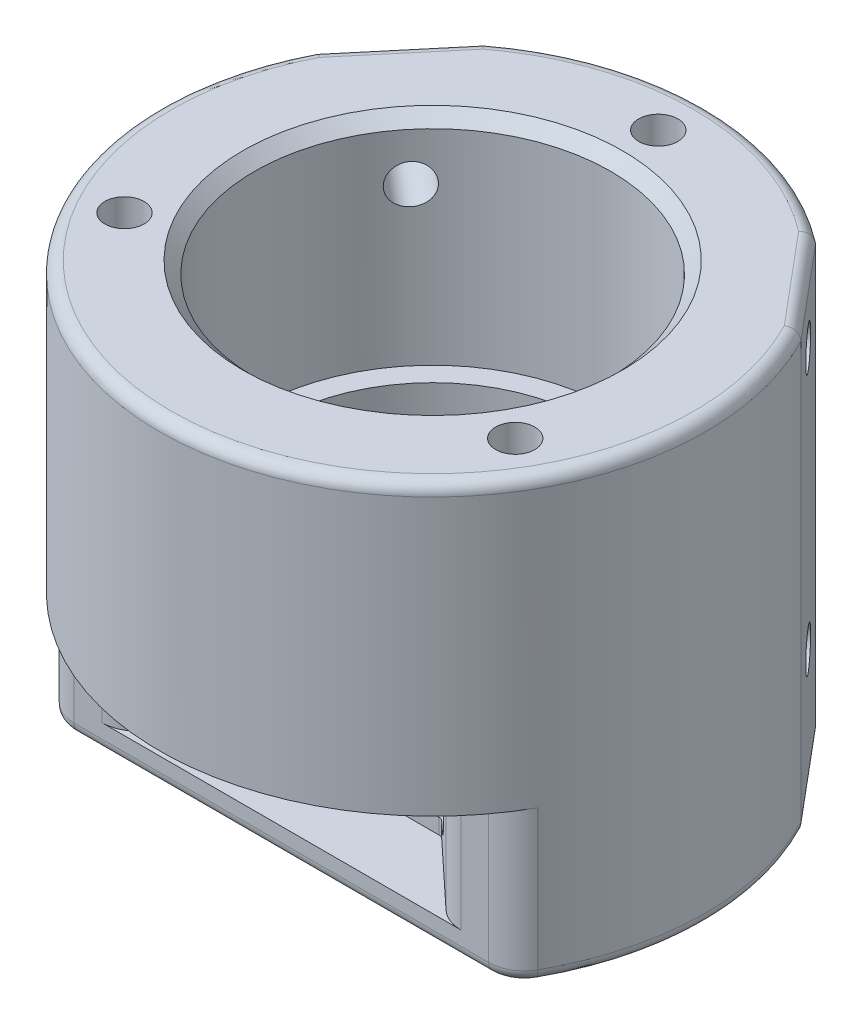
from build123d import *

# Parameters (mm, degrees)
CSK_FOR_M2_COUNTERSUNK_FLAT_HEAD_SCREW1_D           = 2.2
CSK_FOR_M2_COUNTERSUNK_FLAT_HEAD_SCREW1_CSINK_D     = 4.4
CSK_FOR_M2_COUNTERSUNK_FLAT_HEAD_SCREW1_CSINK_ANGLE = 90
CUT_EXTRUDE1_DEPTH                                  = 9.319
CUT_EXTRUDE1_DEPTH_BACK                             = 1.3
FILLET1_R                                           = 3
FILLET2_R                                           = 2
CUT_EXTRUDE3_START                                  = -1.35
CUT_EXTRUDE3_DEPTH                                  = 1.35
M4_TAPPED_HOLE2_D                                   = 3.3
M4_TAPPED_HOLE2_DEPTH                               = 10.1
M4_TAPPED_HOLE2_TIP                                 = 0.991420021
M2_5_TAPPED_HOLE1_D                                 = 2.05
M2_5_TAPPED_HOLE1_DEPTH                             = 6.35
M2_5_TAPPED_HOLE1_TIP                               = 0.615882135
CUT_EXTRUDE4_REACH                                  = 51.335
SKETCH11_OUTSIDE_W                                  = 62.978
SKETCH11_OUTSIDE_H                                  = 62.978
CUT_EXTRUDE2_DEPTH                                  = 50.335229157
FILLET3_R                                           = 1
CHAMFER1_SIZE                                       = 1
M4_TAPPED_HOLE1_AT_2_COUNT                          = 2
M4_TAPPED_HOLE1_AT_2_PITCH                          = 22
FILLET4_R                                           = 0.5


with BuildPart() as part:
    # Sketch1 → Revolve1 (revolve)
    with BuildSketch(Plane(origin=(0, 0, 0), x_dir=(0, 0, -1), z_dir=(1, 0, 0))):
        Polygon((13.2, 3.5), (13.2, 18.844), (15, 18.844), (15, 37.094), (23, 37.094), (23, 16.013248777), (23, 0), (8.5, 0), (5.5, 0), (5.5, 1.35), (3.75, 1.35), (3.75, 3.5), align=None)
    revolve(axis=Axis((0, 0, 0), (0, 1, 0)))

    # CSK for M2 Countersunk Flat Head Screw1 (through all)
    with Locations(Plane(origin=(0, 3.5, 0), x_dir=(1, 0, 0), z_dir=(0, 1, 0))):
        with Locations((0, 6.5), (-5.629165125, -3.25), (5.629165125, -3.25)):
            CounterSinkHole(CSK_FOR_M2_COUNTERSUNK_FLAT_HEAD_SCREW1_D / 2, CSK_FOR_M2_COUNTERSUNK_FLAT_HEAD_SCREW1_CSINK_D / 2, counter_sink_angle=CSK_FOR_M2_COUNTERSUNK_FLAT_HEAD_SCREW1_CSINK_ANGLE)

    # Sketch5 → Cut-Extrude1 (cut, two sides: drawn at the far end of the back side and taken through both)
    with BuildSketch(Plane(origin=(0, 3.5, 0), x_dir=(1, 0, 0), z_dir=(0, 1, 0)).offset(-CUT_EXTRUDE1_DEPTH_BACK)):
        with BuildLine():
            Line((-13.5, -18.62122445), (-13.5, -29.562959847))
            Line((-13.5, -29.562959847), (13.5, -29.562959847))
            Line((13.5, -29.562959847), (13.5, -18.62122445))
            ThreePointArc((13.5, -18.62122445), (16.584015432, -15.936449797), (19.14388926, -12.748))
            Line((19.14388926, -12.748), (13.93421226, -12.748))
            Line((13.93421226, -12.748), (7.5, -6.748))
            Line((7.5, -6.748), (-7.5, -6.748))
            Line((-7.5, -6.748), (-13.93421226, -12.748))
            Line((-13.93421226, -12.748), (-19.14388926, -12.748))
            ThreePointArc((-19.14388926, -12.748), (-16.584015432, -15.936449797), (-13.5, -18.62122445))
        make_face()
    extrude(amount=CUT_EXTRUDE1_DEPTH + CUT_EXTRUDE1_DEPTH_BACK, mode=Mode.SUBTRACT)

    # Fillet1
    fillet1_edges = [part.edges().sort_by_distance(p)[0] for p in [
        (-19.14388926, 7.5095, 12.748),
        (-13.93421226, 7.5095, 12.748),
        (13.93421226, 7.5095, 12.748),
        (19.14388926, 7.5095, 12.748),
    ]]
    fillet(fillet1_edges, radius=FILLET1_R)

    # Fillet2
    fillet2_edges = [part.edges().sort_by_distance(p)[0] for p in [
        (12.06906123, 3.5, -5.345817152),
    ]]
    fillet(fillet2_edges, radius=FILLET2_R)

    # Sketch14 → Cut-Extrude3 (cut)
    with BuildSketch(Plane.XZ.offset(CUT_EXTRUDE3_START)):
        with BuildLine():
            Line((1.1, -6.5), (1.1, -5.388877434))
            ThreePointArc((1.1, -5.388877434), (4.763139721, -2.75), (5.216904756, 1.741810773))
            Line((5.216904756, 1.741810773), (6.179165125, 2.297372056))
            ThreePointArc((6.179165125, 2.297372056), (6.581793069, 3.8), (5.079165125, 4.202627944))
            Line((5.079165125, 4.202627944), (4.116904756, 3.647066661))
            ThreePointArc((4.116904756, 3.647066661), (0, 5.5), (-4.116904756, 3.647066661))
            Line((-4.116904756, 3.647066661), (-5.079165125, 4.202627944))
            ThreePointArc((-5.079165125, 4.202627944), (-6.581793069, 3.8), (-6.179165125, 2.297372056))
            Line((-6.179165125, 2.297372056), (-5.216904756, 1.741810773))
            ThreePointArc((-5.216904756, 1.741810773), (-4.763139721, -2.75), (-1.1, -5.388877434))
            Line((-1.1, -5.388877434), (-1.1, -6.5))
            ThreePointArc((-1.1, -6.5), (0, -7.6), (1.1, -6.5))
        make_face()
    extrude(amount=CUT_EXTRUDE3_DEPTH, mode=Mode.SUBTRACT)

    # M4 Tapped Hole2
    with Locations(Plane(origin=(0, 37.094, 0), x_dir=(-1, 0, 0), z_dir=(0, 1, 0))):
        with Locations((16.454482672, 9.5), (0, -19), (-16.454482672, 9.5)):
            Hole(M4_TAPPED_HOLE2_D / 2, depth=M4_TAPPED_HOLE2_DEPTH)
            with Locations((0, 0, -(M4_TAPPED_HOLE2_DEPTH + M4_TAPPED_HOLE2_TIP / 2))):  # 118° drill point
                Cone(0, M4_TAPPED_HOLE2_D / 2, M4_TAPPED_HOLE2_TIP, mode=Mode.SUBTRACT)

    # M2.5 Tapped Hole1
    with Locations(Plane(origin=(0, 12.819, 0), x_dir=(-1, 0, 0), z_dir=(0, -1, 0))):
        with Locations((-10.4775, -15.748), (10.4775, -15.748)):
            Hole(M2_5_TAPPED_HOLE1_D / 2, depth=M2_5_TAPPED_HOLE1_DEPTH)
            with Locations((0, 0, -(M2_5_TAPPED_HOLE1_DEPTH + M2_5_TAPPED_HOLE1_TIP / 2))):  # 118° drill point
                Cone(0, M2_5_TAPPED_HOLE1_D / 2, M2_5_TAPPED_HOLE1_TIP, mode=Mode.SUBTRACT)

    # Sketch15 → Cut-Extrude4 (cut, up to next)
    with BuildSketch(Plane.XZ, mode=Mode.PRIVATE) as cut_extrude4_sk1:
        with BuildLine():
            Line((15.115943687, 12.748), (17.463576266, 12.748))
            ThreePointArc((17.463576266, 12.748), (18.982358673, 12.335141279), (20.083112706, 11.2102))
            ThreePointArc((20.083112706, 11.2102), (0, 23), (-20.083112706, 11.2102))
            ThreePointArc((-20.083112706, 11.2102), (-18.982358673, 12.335141279), (-17.463576266, 12.748))
            Line((-17.463576266, 12.748), (-15.115943687, 12.748))
            Line((-15.115943687, 12.748), (15.115943687, 12.748))
        make_face()
    cut_extrude4_tool1 = extrude(cut_extrude4_sk1.sketch, amount=-CUT_EXTRUDE4_REACH, mode=Mode.PRIVATE) & part.part
    add(cut_extrude4_tool1.solids().sort_by_distance((0, 0, 16.923735))[0], mode=Mode.SUBTRACT)

    # Sketch11 outside → Cut-Extrude2 (cut, through all)
    with BuildSketch(Plane(origin=(0, 0, 0), x_dir=(1, 0, 0), z_dir=(0, 1, 0))):
        Rectangle(SKETCH11_OUTSIDE_W, SKETCH11_OUTSIDE_H)
        with BuildLine():
            Line((13.983717047, 18.260768263), (20.411593144, 10.600323832))
            ThreePointArc((20.411593144, 10.600323832), (0, -23), (-20.411593144, 10.600323832))
            Line((-20.411593144, 10.600323832), (-13.983717047, 18.260768263))
            ThreePointArc((-13.983717047, 18.260768263), (0, 23), (13.983717047, 18.260768263))
        make_face(mode=Mode.SUBTRACT)
    extrude(amount=CUT_EXTRUDE2_DEPTH, mode=Mode.SUBTRACT)

    # Fillet3
    # the kernel refuses this fillet: 1 mm, written as the material it takes off along each edge
    with BuildSketch(Plane(origin=(0, 0, 0), x_dir=(-0.8322161318186808, 0, -0.5544513594002202), z_dir=(0.5544513594002202, 0, -0.8322161318186808))) as fillet3_piece_1:
        with BuildLine():
            CenterArc((23 - FILLET3_R, FILLET3_R), FILLET3_R, 270, 90)
            Line((23 - FILLET3_R, 0), (23, 0))
            Line((23, 0), (23, FILLET3_R))
        make_face()
    revolve(axis=Axis((0, 0, 0), (0, 1, 0)), revolution_arc=62.84276799, mode=Mode.SUBTRACT)
    with BuildSketch(Plane(origin=(17.463576266, 0, 9.748), x_dir=(0, 0, 1), z_dir=(-1, 0, 0))) as fillet3_piece_2:
        with BuildLine():
            CenterArc((3 - FILLET3_R, FILLET3_R), FILLET3_R, 270, 90)
            Line((3, FILLET3_R), (3, 0))
            Line((3, 0), (3 - FILLET3_R, 0))
        make_face()
    revolve(axis=Axis((17.463576266, 0, 9.748), (0, 1, 0)), revolution_arc=60.830166101, mode=Mode.SUBTRACT)
    with BuildSketch(Plane(origin=(-17.463576266, 0, 9.748), x_dir=(-0.8731788133022929, 0, 0.48739999999999956), z_dir=(-0.48739999999999956, 0, -0.8731788133022929))) as fillet3_piece_3:
        with BuildLine():
            CenterArc((3 - FILLET3_R, FILLET3_R), FILLET3_R, 270, 90)
            Line((3 - FILLET3_R, 0), (3, 0))
            Line((3, 0), (3, FILLET3_R))
        make_face()
    revolve(axis=Axis((-17.463576266, 0, 9.748), (0, 1, 0)), revolution_arc=60.830166101, mode=Mode.SUBTRACT)
    with BuildSketch(Plane(origin=(17.463576266, 0, 12.748), x_dir=(0, 1, 0), z_dir=(-1, 0, 0))) as fillet3_piece_4:
        with BuildLine():
            CenterArc((FILLET3_R, FILLET3_R), FILLET3_R, 180, 90)
            Line((0, FILLET3_R), (0, 0))
            Line((0, 0), (FILLET3_R, 0))
        make_face()
    extrude(amount=34.927152532, mode=Mode.SUBTRACT)
    with BuildSketch(Plane(origin=(0, 37.094, 0), x_dir=(-0.8320605059369173, 0, -0.5546848785211302), z_dir=(0.5546848785211302, 0, -0.8320605059369173))) as fillet3_piece_5:
        with BuildLine():
            CenterArc((23 - FILLET3_R, -FILLET3_R), FILLET3_R, 0, 90)
            Line((23 - FILLET3_R, 0), (23, 0))
            Line((23, 0), (23, -FILLET3_R))
        make_face()
    revolve(axis=Axis((0, 37.094, 0), (0, 1, 0)), revolution_arc=247.378025481, mode=Mode.SUBTRACT)
    with BuildSketch(Plane(origin=(0, 37.094, 0), x_dir=(0.6905501820120585, 0, -0.7232844849180111), z_dir=(0.7232844849180111, 0, 0.6905501820120585))) as fillet3_piece_6:
        with BuildLine():
            CenterArc((23 - FILLET3_R, -FILLET3_R), FILLET3_R, 0, 90)
            Line((23 - FILLET3_R, 0), (23, 0))
            Line((23, 0), (23, -FILLET3_R))
        make_face()
    revolve(axis=Axis((0, 37.094, 0), (0, 1, 0)), revolution_arc=87.347352667, mode=Mode.SUBTRACT)
    with BuildSketch(Plane(origin=(0, 0, 0), x_dir=(-0.6905501820120575, 0, -0.7232844849180122), z_dir=(-0.7232844849180122, 0, 0.6905501820120575))) as fillet3_piece_7:
        with BuildLine():
            CenterArc((23 - FILLET3_R, -FILLET3_R), FILLET3_R, 0, 90)
            Line((23 - FILLET3_R, 0), (23, 0))
            Line((23, 0), (23, -FILLET3_R))
        make_face()
    revolve(axis=Axis((0, 0, 0), (0, -1, 0)), revolution_arc=87.347352667, mode=Mode.SUBTRACT)
    with BuildSketch(Plane(origin=(0, 0, 0), x_dir=(0.8731788133022923, 0, 0.48740000000000056), z_dir=(-0.48740000000000056, 0, 0.8731788133022923))) as fillet3_piece_8:
        with BuildLine():
            CenterArc((23 - FILLET3_R, FILLET3_R), FILLET3_R, 270, 90)
            Line((23 - FILLET3_R, 0), (23, 0))
            Line((23, 0), (23, FILLET3_R))
        make_face()
    revolve(axis=Axis((0, 0, 0), (0, 1, 0)), revolution_arc=62.84276799, mode=Mode.SUBTRACT)
    with BuildSketch(Plane(origin=(-22.018562168, 37.094, -8.685212724), x_dir=(0, -1, 0), z_dir=(0.6427876096865434, 0, -0.7660444431189748))) as fillet3_piece_9:
        with BuildLine():
            CenterArc((FILLET3_R, -FILLET3_R), FILLET3_R, 90, 90)
            Line((0, -FILLET3_R), (0, 0))
            Line((0, 0), (FILLET3_R, 0))
        make_face()
    extrude(amount=15, mode=Mode.SUBTRACT)
    with BuildSketch(Plane(origin=(12.376748023, 37.094, -20.175879371), x_dir=(-0.7660444431189747, 0, 0.6427876096865432), z_dir=(0.6427876096865434, 0, 0.7660444431189748)), Plane(origin=(12.376748023, 0, -20.175879371), x_dir=(0, 1, 0), z_dir=(0.6427876096865434, 0, 0.7660444431189748)), Plane(origin=(-22.018562168, 0, -8.685212724), x_dir=(0, 1, 0), z_dir=(0.6427876096865434, 0, -0.7660444431189748))) as fillet3_piece_10:
        with BuildLine():
            CenterArc((FILLET3_R, FILLET3_R), FILLET3_R, 180, 90)
            Line((0, FILLET3_R), (0, 0))
            Line((0, 0), (FILLET3_R, 0))
        make_face()
    extrude(amount=15, mode=Mode.SUBTRACT)

    # Chamfer1
    chamfer1_edges = [part.edges().sort_by_distance(p)[0] for p in [
        (0, 37.094, 15),
    ]]
    chamfer(chamfer1_edges, length=CHAMFER1_SIZE)

    # Sketch12 → M4 Tapped Hole1 (revolve, cut)
    with BuildSketch(Plane(origin=(17.197655095, 10.094, -14.430546047), x_dir=(-0.6427876096865435, 0, -0.7660444431189747), z_dir=(0, 1, 0))):
        Polygon((0, 0), (0, 11.091420021), (1.65, 10.1), (1.65, 0), align=None)
    m4_tapped_hole1 = revolve(axis=Axis((22.062037309, 10.094, -18.512247369), (-0.7660444431189746, 0, 0.6427876096865435)), mode=Mode.SUBTRACT)

    # M4 Tapped Hole1 at 2: M4 Tapped Hole1 ×2
    with Locations(*[(0, i * M4_TAPPED_HOLE1_AT_2_PITCH, 0) for i in range(1, M4_TAPPED_HOLE1_AT_2_COUNT)]):
        add(m4_tapped_hole1, mode=Mode.SUBTRACT)

    # Mirror1: M4 Tapped Hole1 across plane
    add(m4_tapped_hole1.mirror(Plane(origin=(0, 0, 0), x_dir=(0, 0, 1), z_dir=(1, 0, 0))), mode=Mode.SUBTRACT)

    # Mirror1 copy 1 sketch → Mirror1 copy 1 (revolve, cut)
    with BuildSketch(Plane(origin=(-17.197655095, 32.094, -14.430546047), x_dir=(0.6427876096865435, 0, -0.7660444431189747), z_dir=(0, 1, 0))):
        Polygon((0, 0), (0, -11.091420021), (1.65, -10.1), (1.65, 0), align=None)
    revolve(axis=Axis((-22.062037309, 32.094, -18.512247369), (-0.7660444431189746, 0, -0.6427876096865435)), mode=Mode.SUBTRACT)

    # Fillet4
    fillet4_edges = [part.edges().sort_by_distance(p)[0] for p in [
        (-7.5, 2.85, 6.748),
        (7.5, 2.85, 6.748),
    ]]
    fillet(fillet4_edges, radius=FILLET4_R)


solid = part.part
